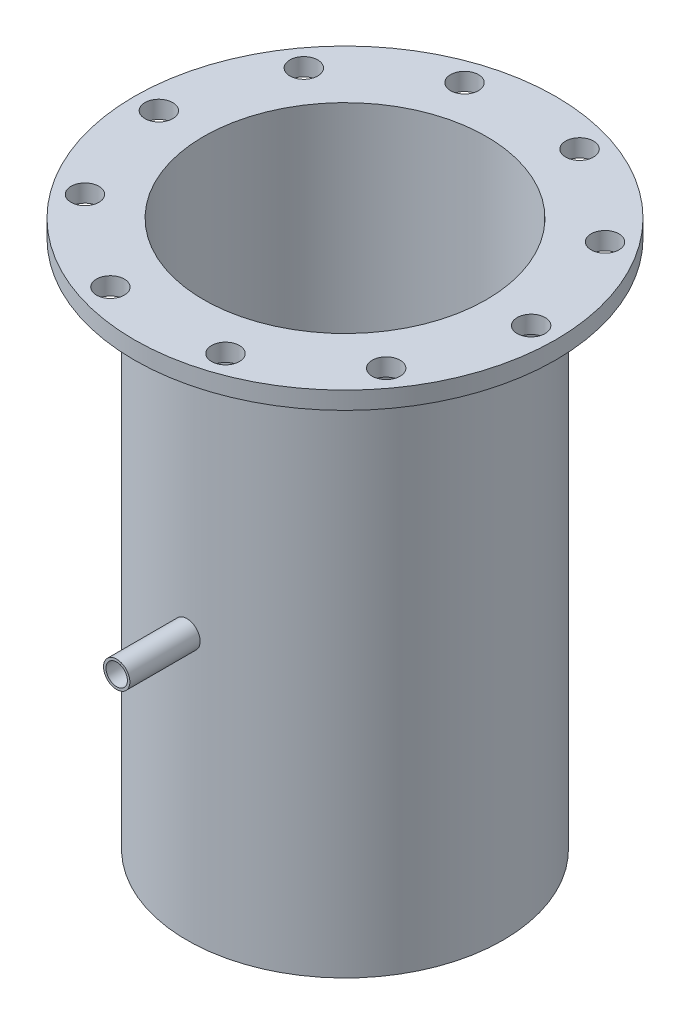
from build123d import *

# Parameters (mm, degrees)
TAP_DRILL_FOR_3_8_16_TAP1_D = 10.0838
CIRPATTERN1_COUNT           = 10
SKETCH4_R                   = 4.7625
SKETCH4_R_2                 = 3.8735
BOSS_EXTRUDE1_DEPTH         = 25.4


with BuildPart() as part:
    # Sketch1 → Revolve1 (revolve)
    with BuildSketch(Plane.XY):
        Polygon((51.1302, 0), (51.1302, -184.978963516), (53.848, -184.978963516), (53.848, -188.026963516), (51.1302, -188.026963516), (51.1302, -197.551963516), (57.15, -197.551963516), (57.15, -8.89), (54.61, -6.35), (76.2, -6.35), (76.2, 0), align=None)
    revolve(axis=Axis((0, 0, 0), (0, -1, 0)))

    # Tap Drill for 3/8-16 Tap1 (through all)
    with Locations(Plane(origin=(0, 0, 0), x_dir=(1, 0, 0), z_dir=(0, 1, 0))):
        with Locations((67.31, 0)):
            tap_drill_for_3_8_16_tap1 = Hole(TAP_DRILL_FOR_3_8_16_TAP1_D / 2)

    # CirPattern1: Tap Drill for 3/8-16 Tap1 ×10 about axis
    cirpattern1_axis = Axis((0, 0, 0), (0, 1, 0))
    for i in range(1, CIRPATTERN1_COUNT):
        add(tap_drill_for_3_8_16_tap1.rotate(cirpattern1_axis, i * 360 / CIRPATTERN1_COUNT), mode=Mode.SUBTRACT)

    # Sketch11 → 1/8 (0.125) Diameter Hole3 (revolve, cut)
    with BuildSketch(Plane(origin=(0, -101.6, 57.15), x_dir=(0, -1, 0), z_dir=(1, 0, 0))):
        Polygon((0, 0), (0, 26.353866233), (1.5875, 25.4), (1.5875, 0), align=None)
    revolve(axis=Axis((0, -101.6, 63.5), (0, 0, -1)), mode=Mode.SUBTRACT)


with BuildPart() as body_2:
    # Sketch4 → Boss-Extrude1 (new body)
    with BuildSketch(Plane.XY.offset(57.15)):
        with Locations((0, -101.6)):
            Circle(SKETCH4_R)
        with Locations((0, -101.6)):
            Circle(SKETCH4_R_2, mode=Mode.SUBTRACT)
    extrude(amount=BOSS_EXTRUDE1_DEPTH)


solid = Compound([part.part, body_2.part])
